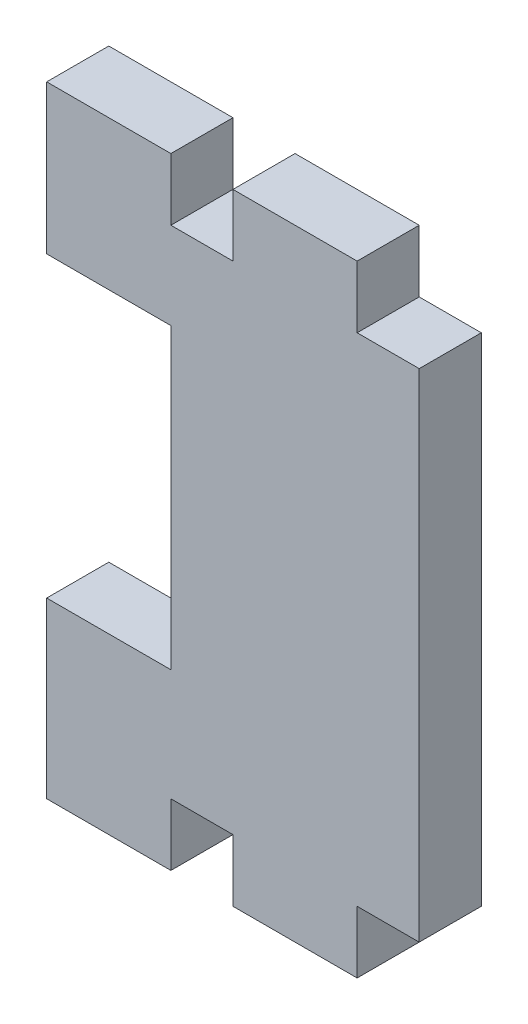
from build123d import *

# Parameters (mm, degrees)
BOSS_EXTRU_1_DEPTH = 5


with BuildPart() as part:
    # Esquisse1 → Boss.-Extru.1 (new body)
    with BuildSketch(Plane.XY):
        Polygon((10, 0), (15, 0), (15, -5), (25, -5), (25, 0), (30, 0), (30, 40), (25, 40), (25, 45), (15, 45), (15, 40), (10, 40), (10, 45), (0, 45), (0, 40), (0, 33), (10, 33), (10, 9), (0, 9), (0, 0), (0, -5), (10, -5), align=None)
    extrude(amount=BOSS_EXTRU_1_DEPTH)


solid = part.part
